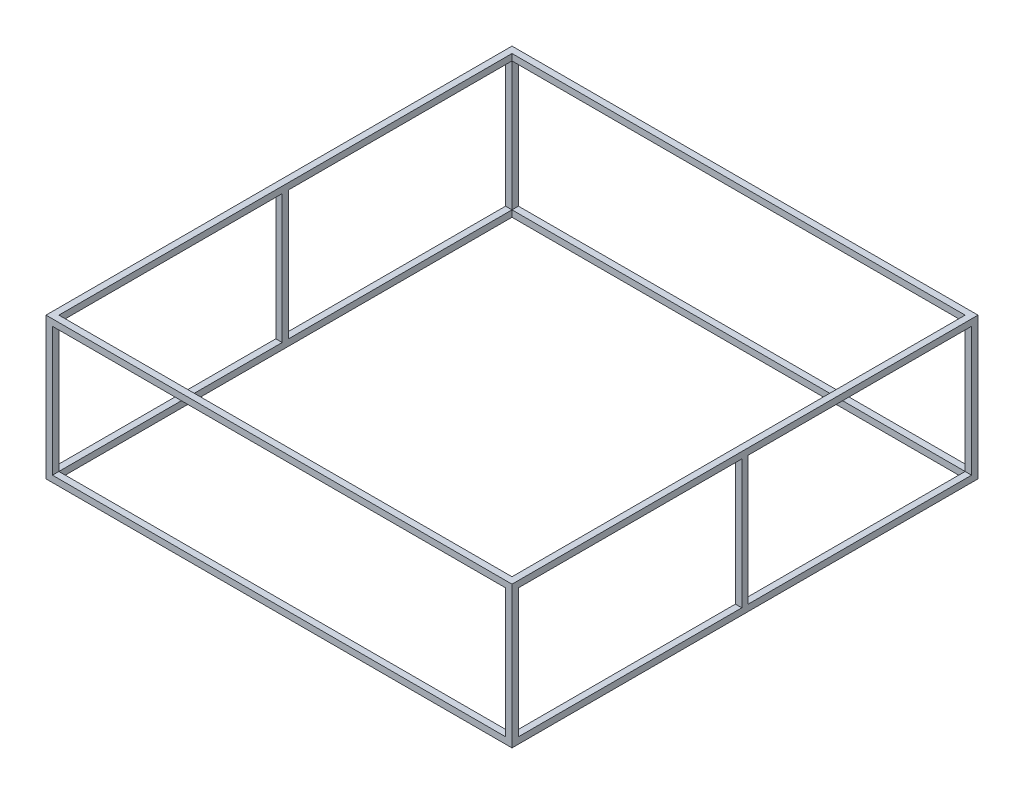
from build123d import *

# Parameters (mm, degrees)
SKETCH1_W           = 1150
SKETCH1_H           = 1150
SKETCH1_W_2         = 1118.25
SKETCH1_H_2         = 1118.25
BOSS_EXTRUDE1_DEPTH = 15.875
SKETCH2_W           = 15.875
SKETCH2_H           = 15.875
BOSS_EXTRUDE2_DEPTH = 318.25
SKETCH3_W           = 1150
SKETCH3_H           = 1150
SKETCH3_W_2         = 1118.25
SKETCH3_H_2         = 1118.25
BOSS_EXTRUDE3_DEPTH = 15.875


with BuildPart() as part:
    # Sketch1 → Boss-Extrude1 (new body)
    with BuildSketch(Plane(origin=(0, 0, 0), x_dir=(1, 0, 0), z_dir=(0, 1, 0))):
        Rectangle(SKETCH1_W, SKETCH1_H)
        Rectangle(SKETCH1_W_2, SKETCH1_H_2, mode=Mode.SUBTRACT)
    extrude(amount=BOSS_EXTRUDE1_DEPTH)

    # Sketch2 → Boss-Extrude2 (add)
    with BuildSketch(Plane(origin=(0, 15.875, 0), x_dir=(1, 0, 0), z_dir=(0, 1, 0))):
        with Locations((-567.0625, 567.0625)):
            Rectangle(SKETCH2_W, SKETCH2_H)
        with Locations((-567.0625, -567.0625)):
            Rectangle(SKETCH2_W, SKETCH2_H)
        with Locations((-567.0625, 0)):
            Rectangle(SKETCH2_W, SKETCH2_H)
    boss_extrude2 = extrude(amount=BOSS_EXTRUDE2_DEPTH)

    # Sketch3 → Boss-Extrude3 (add)
    with BuildSketch(Plane(origin=(0, 334.125, 0), x_dir=(1, 0, 0), z_dir=(0, 1, 0))):
        Rectangle(SKETCH3_W, SKETCH3_H)
        Rectangle(SKETCH3_W_2, SKETCH3_H_2, mode=Mode.SUBTRACT)
    extrude(amount=BOSS_EXTRUDE3_DEPTH)

    # Mirror1: Boss-Extrude2 across plane
    add(boss_extrude2.mirror(Plane(origin=(0, 0, 0), x_dir=(0, 0, 1), z_dir=(1, 0, 0))))


solid = part.part
